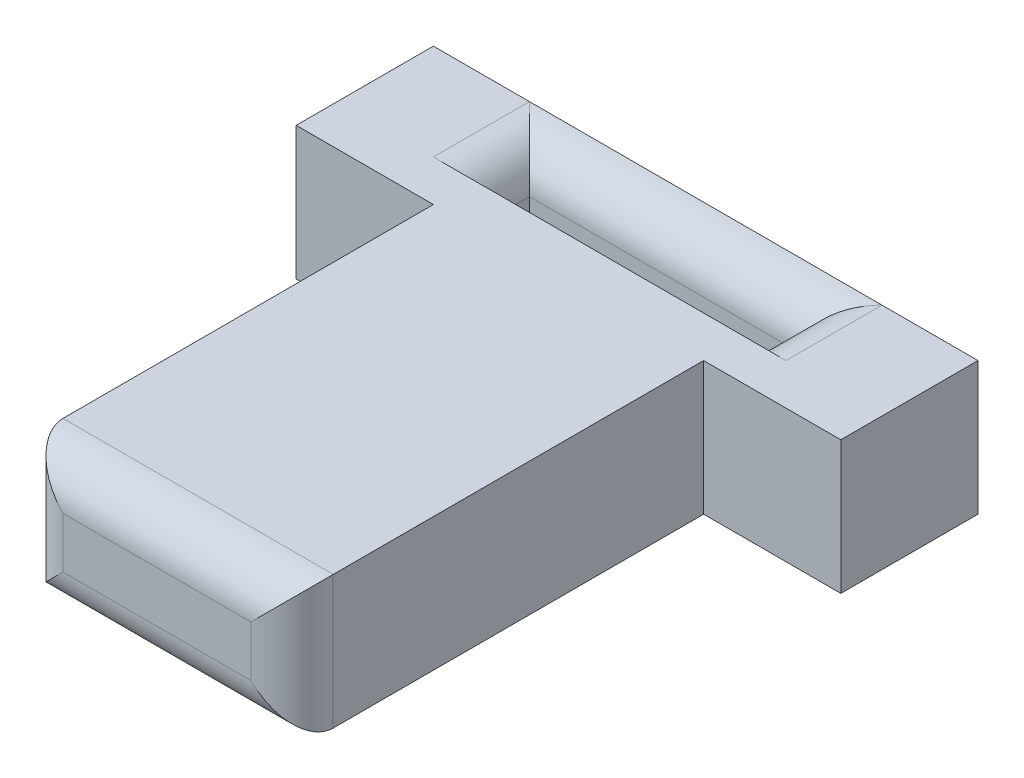
from build123d import *

# Parameters (mm, degrees)
SKETCH1_W           = 19.7
SKETCH1_H           = 9.7
BOSS_EXTRUDE1_DEPTH = 30
SKETCH2_W           = 39.7
SKETCH2_H           = 9.7
BOSS_EXTRUDE2_DEPTH = 10
SKETCH3_W           = 19.7
SKETCH3_H           = 4
CUT_EXTRUDE1_DEPTH  = 10
FILLET1_R           = 3
FILLET2_R           = 3


with BuildPart() as part:
    # Sketch1 → Boss-Extrude1 (new body)
    with BuildSketch(Plane.XY):
        Rectangle(SKETCH1_W, SKETCH1_H)
    extrude(amount=BOSS_EXTRUDE1_DEPTH)

    # Sketch2 → Boss-Extrude2 (add)
    with BuildSketch(Plane(origin=(0, 0, 0), x_dir=(-1, 0, 0), z_dir=(0, 0, -1))):
        Rectangle(SKETCH2_W, SKETCH2_H)
    extrude(amount=BOSS_EXTRUDE2_DEPTH)

    # Sketch3 → Cut-Extrude1 (cut)
    with BuildSketch(Plane(origin=(0, 4.85, 0), x_dir=(1, 0, 0), z_dir=(0, 1, 0))):
        with Locations((0, 5)):
            Rectangle(SKETCH3_W, SKETCH3_H)
    extrude(amount=-CUT_EXTRUDE1_DEPTH, mode=Mode.SUBTRACT)

    # Fillet1
    fillet1_edges = [part.edges().sort_by_distance(p)[0] for p in [
        (-9.85, -4.85, -5),
        (0, -4.85, -7),
        (9.85, -4.85, -5),
        (-9.85, 4.85, -5),
        (9.85, 4.85, -5),
        (0, 4.85, -7),
    ]]
    fillet(fillet1_edges, radius=FILLET1_R - 0.0001)  # a hair under: the kernel refuses the full size

    # Fillet2
    fillet2_edges = [part.edges().sort_by_distance(p)[0] for p in [
        (9.85, 0, 30),
        (0, 4.85, 30),
        (-9.85, 0, 30),
        (0, -4.85, 30),
    ]]
    fillet(fillet2_edges, radius=FILLET2_R)


solid = part.part
